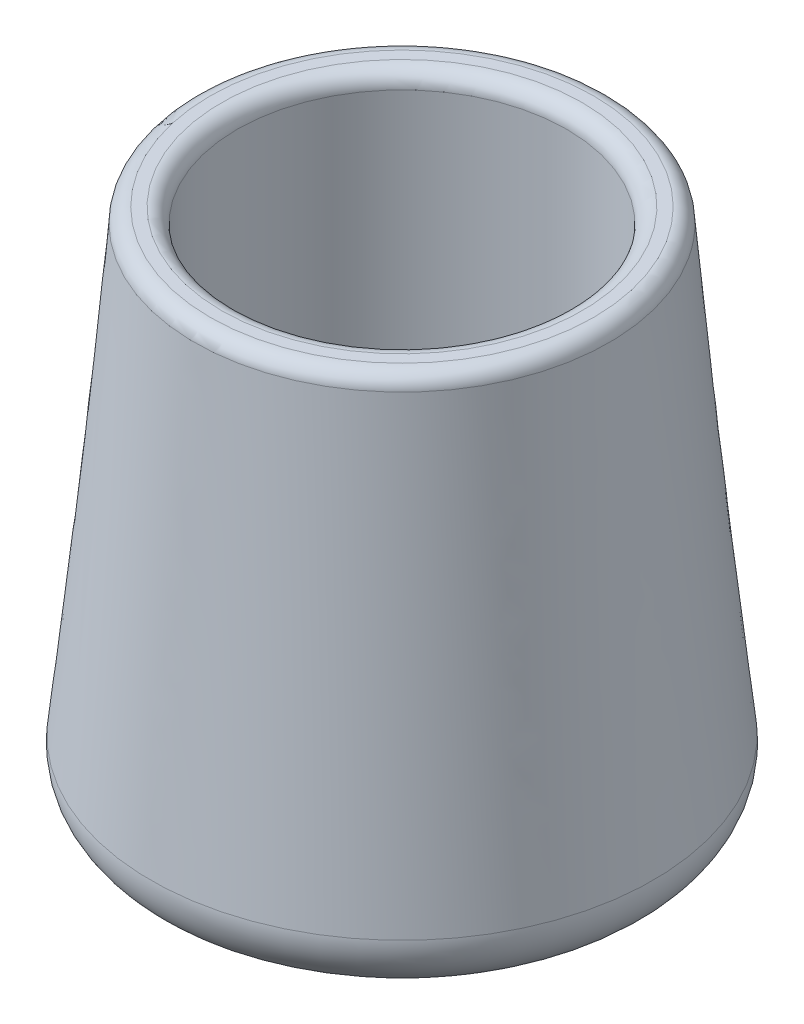
from build123d import *

# Parameters (mm, degrees)
SKETCH2_R          = 8.128
CUT_EXTRUDE1_DEPTH = 12.7
FILLET1_R          = 2.54
FILLET2_R          = 0.762


with BuildPart() as part:
    # Loft1: read off the stored shape, not the designer's step
    # Loft1: loft between two sections, ruled curve by curve
    loft1_from = [
        Edge.make_bspline([(-6.387278158, 25.4, 7.901156734), (-22.189591626, 25.4, -4.873399581), (-9.41503531, 25.4, -20.675713049), (6.387278158, 25.4, -7.901156734), (22.189591626, 25.4, 4.873399581), (9.41503531, 25.4, 20.675713049), (-6.387278158, 25.4, 7.901156734)], [0, 0, 0, 0, 0.5, 0.5, 0.5, 1, 1, 1, 1], 3, [1, 0.333333333, 0.333333333, 1, 0.333333333, 0.333333333, 1]),
    ]
    loft1_to = [
        Edge.make_bspline([(-5.094992756, 0, 11.633187388), (-28.361367533, 0, 1.443201876), (-18.17138202, 0, -21.823172901), (5.094992756, 0, -11.633187388), (28.361367533, 0, -1.443201876), (18.17138202, 0, 21.823172901), (-5.094992756, 0, 11.633187388)], [0, 0, 0, 0, 0.5, 0.5, 0.5, 1, 1, 1, 1], 3, [1, 0.333333333, 0.333333333, 1, 0.333333333, 0.333333333, 1]),
    ]
    loft1 = Solid(Shell([*[Face.make_surface_from_curves(loft1_from[k], loft1_to[k]) for k in range(1)], Face(Wire(loft1_from)), Face(Wire(loft1_to))]))
    add(loft1)

    # Sketch2 → Cut-Extrude1 (cut)
    with BuildSketch(Plane(origin=(0, 25.4, 0), x_dir=(1, 0, 0), z_dir=(0, 1, 0))):
        with Locations(Location((0, 0, 0), (0, 0, 270))):
            Circle(SKETCH2_R)
    extrude(amount=-CUT_EXTRUDE1_DEPTH, mode=Mode.SUBTRACT)

    # Fillet1
    fillet1_edges = [part.edges().sort_by_distance(p)[0] for p in [
        (5.094992756, 0, -11.633187388),
    ]]
    fillet(fillet1_edges, radius=FILLET1_R)

    # Fillet2
    fillet2_edges = [part.edges().sort_by_distance(p)[0] for p in [
        (6.387278158, 25.4, -7.901156734),
        (0, 25.4, -8.128),
    ]]
    fillet(fillet2_edges, radius=FILLET2_R)


solid = part.part
